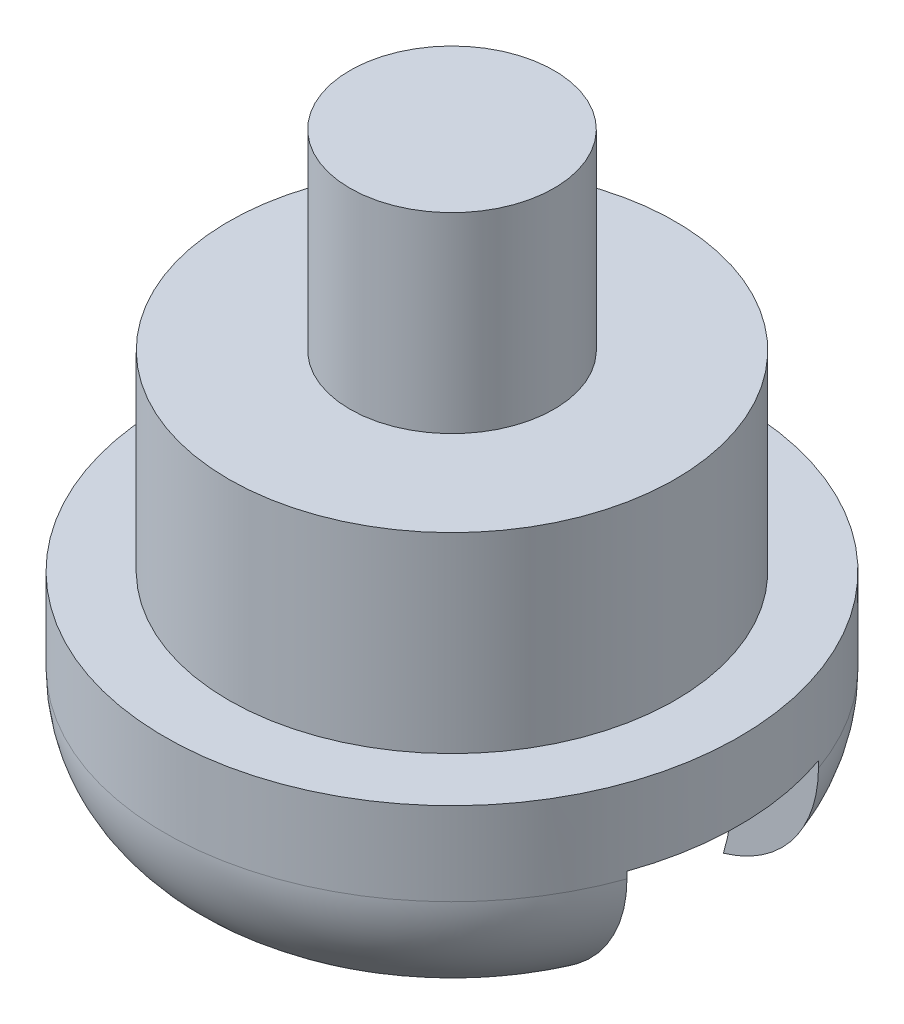
from build123d import *

# Parameters (mm, degrees)
SKETCH1_R      = 3.5
BASE_DEPTH     = 3
SKETCH2_R      = 1.6
PEG_DEPTH      = 3
SKETCH5_R      = 4.5
HOLDER_DEPTH   = 3.2
SKETCH8_W      = 12
SKETCH8_H      = 3
CUT_SLOT_DEPTH = 2
FILLET1_R      = 2


with BuildPart() as part:
    # Sketch1 → base (new body)
    with BuildSketch(Plane(origin=(0, 0, 0), x_dir=(1, 0, 0), z_dir=(0, 1, 0))):
        with Locations(Location((0, 0, 0), (0, 0, 270))):
            Circle(SKETCH1_R)
    extrude(amount=BASE_DEPTH)

    # Sketch2 → peg (add)
    with BuildSketch(Plane(origin=(0, 3, 0), x_dir=(1, 0, 0), z_dir=(0, 1, 0))):
        with Locations(Location((0, 0, 0), (0, 0, 270))):
            Circle(SKETCH2_R)
    extrude(amount=PEG_DEPTH)

    # Sketch5 → holder (add)
    with BuildSketch(Plane.XZ):
        with Locations(Location((0, 0, 0), (0, 0, 270))):
            Circle(SKETCH5_R)
    extrude(amount=HOLDER_DEPTH)

    # Sketch6 → Cut-ball (revolve, cut)
    with BuildSketch(Plane(origin=(0, 0, 0), x_dir=(0, 0, -1), z_dir=(1, 0, 0))):
        with BuildLine():
            Line((0, 0.902192429), (0, -5.597807571))
            ThreePointArc((0, -5.597807571), (-3.25, -2.347807571), (0, 0.902192429))
        make_face()
    revolve(axis=Axis((0, 6, 0), (0, -1, 0)), mode=Mode.SUBTRACT)

    # Sketch8 → Cut-slot (cut)
    with BuildSketch(Plane.XZ.offset(3.2)):
        Rectangle(SKETCH8_W, SKETCH8_H)
    extrude(amount=-CUT_SLOT_DEPTH, mode=Mode.SUBTRACT)

    # Fillet1
    # the kernel refuses this fillet: 2 mm, written as the material it takes off along each edge
    with BuildSketch(Plane(origin=(0, -3.2, 0), x_dir=(0, 0, -1), z_dir=(-1, 0, 0))) as fillet1_piece_1:
        with BuildLine():
            CenterArc((2.5, -1.896086641), FILLET1_R, 0, 71.449446556)
            Line((3.136282523, 0), (3.149008174, 0.037921733))
            ThreePointArc((3.149008174, 0.037921733), (3.818141262, 0.04), (4.5, 0.04))
            Line((4.5, 0.04), (4.54, 0))
            Line((4.54, 0), (4.54, -1.896086641))
            Line((4.54, -1.896086641), (4.5, -1.896086641))
        make_face()
    revolve(axis=Axis((0, -3.2, 0), (0, -1, 0)), revolution_arc=130.897979083, mode=Mode.SUBTRACT)
    with BuildSketch(Plane(origin=(0, -3.2, 0), x_dir=(0.7553656278426528, 0, -0.6553035695567931), z_dir=(-0.6553035695567931, 0, -0.7553656278426528))) as fillet1_piece_2:
        with BuildLine():
            CenterArc((2.5, -1.896086641), FILLET1_R, 0, 71.449446556)
            Line((3.136282523, 0), (3.149008174, 0.037921733))
            ThreePointArc((3.149008174, 0.037921733), (3.818141262, 0.04), (4.5, 0.04))
            Line((4.5, 0.04), (4.54, 0))
            Line((4.54, 0), (4.54, -1.896086641))
            Line((4.54, -1.896086641), (4.5, -1.896086641))
        make_face()
    revolve(axis=Axis((0, -3.2, 0), (0, -1, 0)), revolution_arc=261.88534443, mode=Mode.SUBTRACT)
    with BuildSketch(Plane(origin=(0, -3.2, 0), x_dir=(-0.7558765624849457, 0, 0.6547141531125946), z_dir=(0.6547141531125946, 0, 0.7558765624849457))) as fillet1_piece_3:
        with BuildLine():
            CenterArc((2.5, -1.896086641), FILLET1_R, 0, 71.449446556)
            Line((3.136282523, 0), (3.149008174, 0.037921733))
            ThreePointArc((3.149008174, 0.037921733), (3.818141262, 0.04), (4.5, 0.04))
            Line((4.5, 0.04), (4.54, 0))
            Line((4.54, 0), (4.54, -1.896086641))
            Line((4.54, -1.896086641), (4.5, -1.896086641))
        make_face()
    revolve(axis=Axis((0, -3.2, 0), (0, -1, 0)), revolution_arc=130.897979083, mode=Mode.SUBTRACT)


solid = part.part
